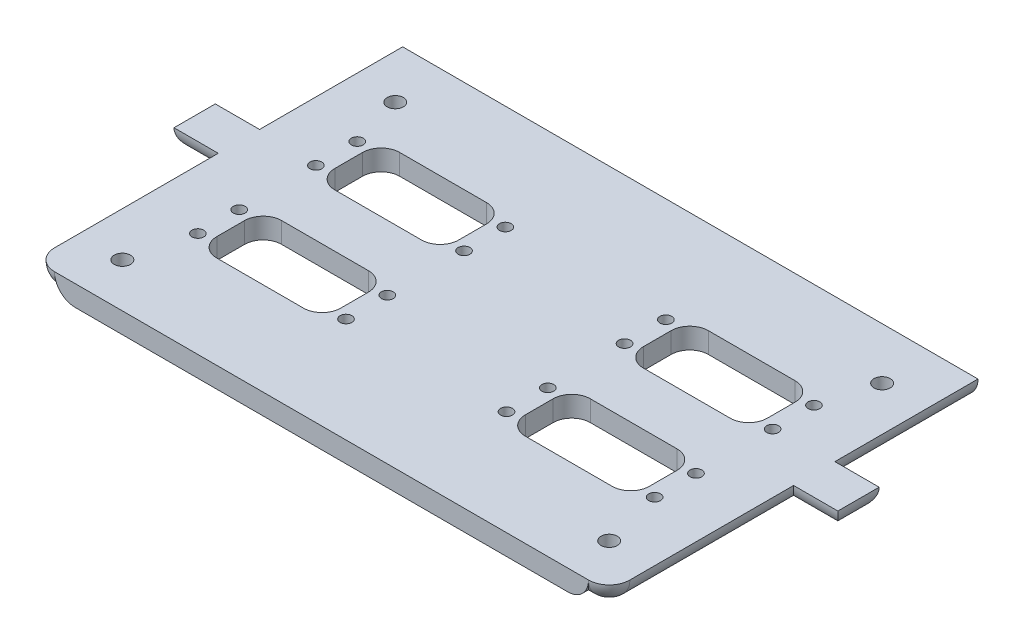
from build123d import *

# Parameters (mm, degrees)
SKETCH2_W               = 195
SKETCH2_H               = 125
BOSS_EXTRUDE1_DEPTH     = 57
SKETCH3_W               = 181
SKETCH3_H               = 118
CUT_EXTRUDE1_DEPTH      = 50
BOSS_EXTRUDE2_DEPTH     = 15
CUT_EXTRUDE4_REACH      = 179.568
SKETCH7_R               = 2.75
SKETCH34_R              = 2
SKETCH34_W              = 22
SKETCH34_H              = 42
CUT_EXTRUDE8_DEPTH      = 7
MIRROR2_COPY_1_DEPTH    = 15
MIRROR2_COPY_2_REACH    = 179.568
MIRROR2_COPY_2_SKETCH_R = 2.75
MIRROR2_COPY_3_SKETCH_R = 2
MIRROR2_COPY_3_SKETCH_W = 22
MIRROR2_COPY_3_SKETCH_H = 42
MIRROR2_COPY_3_DEPTH    = 7
FILLET2_R               = 7
FILLET7_R               = 7
BOSS_EXTRUDE8_REACH     = 282.009
BOSS_EXTRUDE9_REACH     = 282.009
SKETCH29_W              = 460.325022979
SKETCH29_H              = 444.411594697
CUT_EXTRUDE5_DEPTH      = 50
SKETCH30_R              = 48
BOSS_EXTRUDE10_DEPTH    = 11
SKETCH31_R              = 41
CUT_EXTRUDE6_DEPTH      = 11
SKETCH32_R              = 3.2
CUT_EXTRUDE7_DEPTH      = 7
FILLET8_R               = 7
FILLET11_R              = 6.3
SKETCH37_W              = 42
SKETCH37_H              = 75
BOSS_EXTRUDE11_DEPTH    = 7
SKETCH39_W              = 254.771763885
SKETCH39_H              = 96.813270276
CUT_EXTRUDE9_DEPTH      = 125
SKETCH40_W              = 43.421970192
SKETCH40_H              = 69.563768573
BOSS_EXTRUDE12_DEPTH    = 7
SKETCH41_R              = 2
CUT_EXTRUDE10_DEPTH     = 7


with BuildPart() as part:
    # Sketch2 → Boss-Extrude1 (new body)
    with BuildSketch(Plane(origin=(0, 0, 0), x_dir=(1, 0, 0), z_dir=(0, 1, 0))):
        with Locations((0, -62.5)):
            Rectangle(SKETCH2_W, SKETCH2_H)
    boss_extrude1 = extrude(amount=BOSS_EXTRUDE1_DEPTH)

    # Sketch3 → Cut-Extrude1 (cut)
    with BuildSketch(Plane(origin=(0, 57, 0), x_dir=(1, 0, 0), z_dir=(0, 1, 0))):
        with Locations((0, -59)):
            Rectangle(SKETCH3_W, SKETCH3_H)
    cut_extrude1 = extrude(amount=-CUT_EXTRUDE1_DEPTH, mode=Mode.SUBTRACT)

    # Sketch5 → Boss-Extrude2 (add)
    with BuildSketch(Plane.ZY.offset(97.5)):
        Polygon((48.5, 7), (48.5, 0), (62.5, 0), (62.5, 57), (55.5, 57), (55.5, 7), align=None)
    boss_extrude2 = extrude(amount=BOSS_EXTRUDE2_DEPTH)

    # Sketch7 → Cut-Extrude4 (cut, up to next)
    with BuildSketch(Plane.XZ, mode=Mode.PRIVATE) as cut_extrude4_sk1:
        with Locations(Location((-82.5, 17.5, 0), (0, 0, 270))):
            Circle(SKETCH7_R)
    cut_extrude4_tool1 = extrude(cut_extrude4_sk1.sketch, amount=-CUT_EXTRUDE4_REACH, mode=Mode.PRIVATE) & part.part
    # Sketch7 → Cut-Extrude4 (cut, up to next)
    with BuildSketch(Plane.XZ, mode=Mode.PRIVATE) as cut_extrude4_sk2:
        with Locations(Location((-82.5, 110, 0), (0, 0, 270))):
            Circle(SKETCH7_R)
    cut_extrude4_tool2 = extrude(cut_extrude4_sk2.sketch, amount=-CUT_EXTRUDE4_REACH, mode=Mode.PRIVATE) & part.part
    cut_extrude4_1 = cut_extrude4_tool1.solids().sort_by_distance((-82.5, 0, 17.5))[0]
    add(cut_extrude4_1, mode=Mode.SUBTRACT)
    cut_extrude4_2 = cut_extrude4_tool2.solids().sort_by_distance((-82.5, 0, 110))[0]
    add(cut_extrude4_2, mode=Mode.SUBTRACT)
    cut_extrude4 = cut_extrude4_1 + cut_extrude4_2  # Cut-Extrude4 as one shape, for the pattern or mirror that repeats it

    # Sketch34 → Cut-Extrude8 (cut)
    with BuildSketch(Plane.XZ):
        with Locations(Location((-57.3, 88.85, 0), (0, 0, 270))):
            Circle(SKETCH34_R)
        with Locations(Location((-67.3, 88.85, 0), (0, 0, 270))):
            Circle(SKETCH34_R)
        with Locations(Location((-78.45, 63.75, 0), (0, 0, 270))):
            Circle(SKETCH34_R)
        with Locations(Location((-46.15, 63.75, 0), (0, 0, 270))):
            Circle(SKETCH34_R)
        with Locations(Location((-57.3, 38.65, 0), (0, 0, 270))):
            Circle(SKETCH34_R)
        with Locations(Location((-67.3, 38.65, 0), (0, 0, 270))):
            Circle(SKETCH34_R)
        with Locations((-62.3, 63.75)):
            Rectangle(SKETCH34_W, SKETCH34_H)
    cut_extrude8 = extrude(amount=-CUT_EXTRUDE8_DEPTH, mode=Mode.SUBTRACT)

    # Mirror1: Boss-Extrude2, Cut-Extrude4, Cut-Extrude8 across plane
    add(boss_extrude2.mirror(Plane(origin=(0, 0, 0), x_dir=(0, 0, 1), z_dir=(1, 0, 0))))
    add(cut_extrude4.mirror(Plane(origin=(0, 0, 0), x_dir=(0, 0, 1), z_dir=(1, 0, 0))), mode=Mode.SUBTRACT)
    add(cut_extrude8.mirror(Plane(origin=(0, 0, 0), x_dir=(0, 0, 1), z_dir=(1, 0, 0))), mode=Mode.SUBTRACT)

    # Mirror2: Boss-Extrude1, Cut-Extrude1, Boss-Extrude2, Cut-Extrude4, Cut-Extrude8 across plane
    add(boss_extrude1.mirror(Plane.XY))
    add(cut_extrude1.mirror(Plane.XY), mode=Mode.SUBTRACT)
    add(boss_extrude2.mirror(Plane.XY))
    add(cut_extrude4.mirror(Plane.XY), mode=Mode.SUBTRACT)
    add(cut_extrude8.mirror(Plane.XY), mode=Mode.SUBTRACT)

    # Mirror2 copy 1 sketch → Mirror2 copy 1 (add)
    with BuildSketch(Plane(origin=(97.5, 0, 0), x_dir=(0, 0, -1), z_dir=(1, 0, 0))):
        Polygon((48.5, 7), (48.5, 0), (62.5, 0), (62.5, 57), (55.5, 57), (55.5, 7), align=None)
    extrude(amount=MIRROR2_COPY_1_DEPTH)

    # Mirror2 copy 2 sketch → Mirror2 copy 2 (cut, up to next)
    with BuildSketch(Plane(origin=(0, 0, 0), x_dir=(-1, 0, 0), z_dir=(0, -1, 0)), mode=Mode.PRIVATE) as mirror2_copy_2_sk1:
        with Locations(Location((-82.5, 17.5, 0), (0, 0, 270))):
            Circle(MIRROR2_COPY_2_SKETCH_R)
    mirror2_copy_2_tool1 = extrude(mirror2_copy_2_sk1.sketch, amount=-MIRROR2_COPY_2_REACH, mode=Mode.PRIVATE) & part.part
    # Mirror2 copy 2 sketch → Mirror2 copy 2 (cut, up to next)
    with BuildSketch(Plane(origin=(0, 0, 0), x_dir=(-1, 0, 0), z_dir=(0, -1, 0)), mode=Mode.PRIVATE) as mirror2_copy_2_sk2:
        with Locations(Location((-82.5, 110, 0), (0, 0, 270))):
            Circle(MIRROR2_COPY_2_SKETCH_R)
    mirror2_copy_2_tool2 = extrude(mirror2_copy_2_sk2.sketch, amount=-MIRROR2_COPY_2_REACH, mode=Mode.PRIVATE) & part.part
    add(mirror2_copy_2_tool1.solids().sort_by_distance((82.5, 0, -17.5))[0], mode=Mode.SUBTRACT)
    add(mirror2_copy_2_tool2.solids().sort_by_distance((82.5, 0, -110))[0], mode=Mode.SUBTRACT)

    # Mirror2 copy 3 sketch → Mirror2 copy 3 (cut)
    with BuildSketch(Plane(origin=(0, 0, 0), x_dir=(-1, 0, 0), z_dir=(0, -1, 0))):
        with Locations(Location((-57.3, 88.85, 0), (0, 0, 270))):
            Circle(MIRROR2_COPY_3_SKETCH_R)
        with Locations(Location((-67.3, 88.85, 0), (0, 0, 270))):
            Circle(MIRROR2_COPY_3_SKETCH_R)
        with Locations(Location((-78.45, 63.75, 0), (0, 0, 270))):
            Circle(MIRROR2_COPY_3_SKETCH_R)
        with Locations(Location((-46.15, 63.75, 0), (0, 0, 270))):
            Circle(MIRROR2_COPY_3_SKETCH_R)
        with Locations(Location((-57.3, 38.65, 0), (0, 0, 270))):
            Circle(MIRROR2_COPY_3_SKETCH_R)
        with Locations(Location((-67.3, 38.65, 0), (0, 0, 270))):
            Circle(MIRROR2_COPY_3_SKETCH_R)
        with Locations((-62.3, 63.75)):
            Rectangle(MIRROR2_COPY_3_SKETCH_W, MIRROR2_COPY_3_SKETCH_H)
    extrude(amount=-MIRROR2_COPY_3_DEPTH, mode=Mode.SUBTRACT)

    # Fillet2
    fillet2_edges = [part.edges().sort_by_distance(p)[0] for p in [
        (-97.5, 28.5, -125),
        (97.5, 28.5, -125),
        (97.5, 28.5, 125),
        (-97.5, 28.5, 125),
    ]]
    fillet(fillet2_edges, radius=FILLET2_R)

    # Fillet7
    fillet7_edges = [part.edges().sort_by_distance(p)[0] for p in [
        (97.5, 0, 0),
        (-97.5, 0, 0),
        (97.5, 0, -90.25),
        (-97.5, 0, 90.25),
        (97.5, 0, 90.25),
        (-97.5, 0, -90.25),
        (0, 0, -125),
        (0, 0, 125),
        (112.5, 0, 55.5),
        (105, 0, 62.5),
        (105, 0, 48.5),
        (-112.5, 0, -55.5),
        (-105, 0, -62.5),
        (-105, 0, -48.5),
        (105, 0, -48.5),
        (105, 0, -62.5),
        (112.5, 0, -55.5),
        (-105, 0, 48.5),
        (-105, 0, 62.5),
        (-95.449747468, 0, 122.949747468),
        (-95.449747468, 0, -122.949747468),
        (95.449747468, 0, -122.949747468),
        (95.449747468, 0, 122.949747468),
        (-112.5, 0, 55.5),
    ]]
    fillet(fillet7_edges, radius=FILLET7_R - 0.0001)  # a hair under: the kernel refuses the full size

    # Sketch26 → Boss-Extrude8 (add, up to next)
    with BuildSketch(Plane.XY.offset(125), mode=Mode.PRIVATE) as boss_extrude8_sk1:
        with BuildLine():
            Line((-90.5, 7), (90.5, 7))
            ThreePointArc((90.5, 7), (88.449747468, 2.050252532), (83.5, 0))
            Line((83.5, 0), (-83.5, 0))
            ThreePointArc((-83.5, 0), (-88.449747468, 2.050252532), (-90.5, 7))
        make_face()
    boss_extrude8_tool1 = extrude(boss_extrude8_sk1.sketch, amount=-BOSS_EXTRUDE8_REACH, mode=Mode.PRIVATE) - part.part
    add(boss_extrude8_tool1.solids().sort_by_distance((0, 3.532685, 125))[0])

    # Sketch27 → Boss-Extrude9 (add, up to next)
    with BuildSketch(Plane(origin=(0, 0, -125), x_dir=(-1, 0, 0), z_dir=(0, 0, -1)), mode=Mode.PRIVATE) as boss_extrude9_sk1:
        with BuildLine():
            Line((-90.5, 7), (90.5, 7))
            ThreePointArc((90.5, 7), (88.449747468, 2.050252532), (83.5, 0))
            Line((83.5, 0), (-83.5, 0))
            ThreePointArc((-83.5, 0), (-88.449747468, 2.050252532), (-90.5, 7))
        make_face()
    boss_extrude9_tool1 = extrude(boss_extrude9_sk1.sketch, amount=-BOSS_EXTRUDE9_REACH, mode=Mode.PRIVATE) - part.part
    add(boss_extrude9_tool1.solids().sort_by_distance((0, 3.532685, -125))[0])

    # Sketch29 → Cut-Extrude5 (cut)
    with BuildSketch(Plane(origin=(0, 57, 0), x_dir=(1, 0, 0), z_dir=(0, 1, 0))):
        with Locations((1.552529588, 6.210118353)):
            Rectangle(SKETCH29_W, SKETCH29_H)
    extrude(amount=-CUT_EXTRUDE5_DEPTH, mode=Mode.SUBTRACT)

    # Sketch30 → Boss-Extrude10 (add)
    with BuildSketch(Plane(origin=(0, 7, 0), x_dir=(1, 0, 0), z_dir=(0, 1, 0))):
        with Locations(Location((0, 64, 0), (0, 0, 0.616739929))):
            Circle(SKETCH30_R)
    extrude(amount=BOSS_EXTRUDE10_DEPTH)

    # Sketch31 → Cut-Extrude6 (cut)
    with BuildSketch(Plane.XZ):
        with Locations(Location((0, -64, 0), (0, 0, 270))):
            Circle(SKETCH31_R)
    extrude(amount=-CUT_EXTRUDE6_DEPTH, mode=Mode.SUBTRACT)

    # Sketch32 → Cut-Extrude7 (cut)
    with BuildSketch(Plane.XZ.offset(-11)):
        with Locations(Location((0, -30, 0), (0, 0, 270))):
            Circle(SKETCH32_R)
        with Locations(Location((0, -98, 0), (0, 0, 270))):
            Circle(SKETCH32_R)
        with Locations(Location((34, -64, 0), (0, 0, 270))):
            Circle(SKETCH32_R)
        with Locations(Location((-34, -64, 0), (0, 0, 270))):
            Circle(SKETCH32_R)
    extrude(amount=-CUT_EXTRUDE7_DEPTH, mode=Mode.SUBTRACT)

    # Fillet8
    fillet8_edges = [part.edges().sort_by_distance(p)[0] for p in [
        (-47.997219225, 18, -63.483331143),
    ]]
    fillet(fillet8_edges, radius=FILLET8_R)

    # Fillet11
    fillet11_edges = [part.edges().sort_by_distance(p)[0] for p in [
        (73.3, 3.5, 84.75),
        (73.3, 3.5, 42.75),
        (51.3, 3.5, 42.75),
        (51.3, 3.5, 84.75),
        (-51.3, 3.5, 42.75),
        (-51.3, 3.5, 84.75),
        (-73.3, 3.5, 84.75),
        (-73.3, 3.5, 42.75),
    ]]
    fillet(fillet11_edges, radius=FILLET11_R)

    # Sketch37 → Boss-Extrude11 (add)
    with BuildSketch(Plane.XZ):
        with Locations((64.5, -62.5)):
            Rectangle(SKETCH37_W, SKETCH37_H)
        with Locations((-64.5, -62.5)):
            Rectangle(SKETCH37_W, SKETCH37_H)
    extrude(amount=-BOSS_EXTRUDE11_DEPTH)

    # Sketch39 → Cut-Extrude9 (cut)
    with BuildSketch(Plane(origin=(0, 0, -125), x_dir=(-1, 0, 0), z_dir=(0, 0, -1))):
        with Locations((-2.436947306, 5.612660368)):
            Rectangle(SKETCH39_W, SKETCH39_H)
    extrude(amount=-CUT_EXTRUDE9_DEPTH, mode=Mode.SUBTRACT)

    # Sketch40 → Boss-Extrude12 (add)
    with BuildSketch(Plane.XZ):
        with Locations((-61.588304661, 62.943081328)):
            Rectangle(SKETCH40_W, SKETCH40_H)
    boss_extrude12 = extrude(amount=-BOSS_EXTRUDE12_DEPTH)

    # Sketch41 → Cut-Extrude10 (cut)
    with BuildSketch(Plane.XZ):
        with Locations(Location((-27.2, 89.5, 0), (0, 0, 270))):
            Circle(SKETCH41_R)
        with Locations(Location((-27.2, 75.5, 0), (0, 0, 270))):
            Circle(SKETCH41_R)
        with Locations(Location((-77.4, 75.5, 0), (0, 0, 270))):
            Circle(SKETCH41_R)
        with Locations(Location((-77.4, 89.5, 0), (0, 0, 270))):
            Circle(SKETCH41_R)
        with Locations(Location((-27.2, 49.5, 0), (0, 0, 270))):
            Circle(SKETCH41_R)
        with Locations(Location((-27.2, 35.5, 0), (0, 0, 270))):
            Circle(SKETCH41_R)
        with Locations(Location((-77.4, 35.5, 0), (0, 0, 270))):
            Circle(SKETCH41_R)
        with Locations(Location((-77.4, 49.5, 0), (0, 0, 270))):
            Circle(SKETCH41_R)
        with BuildLine():
            Line((-67, 93.5), (-37.6, 93.5))
            ThreePointArc((-37.6, 93.5), (-33.145227279, 91.654772721), (-31.3, 87.2))
            Line((-31.3, 87.2), (-31.3, 77.8))
            ThreePointArc((-31.3, 77.8), (-33.145227279, 73.345227279), (-37.6, 71.5))
            Line((-37.6, 71.5), (-67, 71.5))
            ThreePointArc((-67, 71.5), (-71.454772721, 73.345227279), (-73.3, 77.8))
            Line((-73.3, 77.8), (-73.3, 87.2))
            ThreePointArc((-73.3, 87.2), (-71.454772721, 91.654772721), (-67, 93.5))
        make_face()
        with BuildLine():
            Line((-67, 53.5), (-37.6, 53.5))
            ThreePointArc((-37.6, 53.5), (-33.145227279, 51.654772721), (-31.3, 47.2))
            Line((-31.3, 47.2), (-31.3, 37.8))
            ThreePointArc((-31.3, 37.8), (-33.145227279, 33.345227279), (-37.6, 31.5))
            Line((-37.6, 31.5), (-67, 31.5))
            ThreePointArc((-67, 31.5), (-71.454772721, 33.345227279), (-73.3, 37.8))
            Line((-73.3, 37.8), (-73.3, 47.2))
            ThreePointArc((-73.3, 47.2), (-71.454772721, 51.654772721), (-67, 53.5))
        make_face()
    cut_extrude10 = extrude(amount=-CUT_EXTRUDE10_DEPTH, mode=Mode.SUBTRACT)

    # Mirror3: Boss-Extrude12 across plane
    add(boss_extrude12.mirror(Plane(origin=(0, 0, 0), x_dir=(0, 0, 1), z_dir=(1, 0, 0))))

    # Mirror4: Cut-Extrude10 across plane
    add(cut_extrude10.mirror(Plane(origin=(0, 0, 0), x_dir=(0, 0, 1), z_dir=(1, 0, 0))), mode=Mode.SUBTRACT)


solid = part.part
